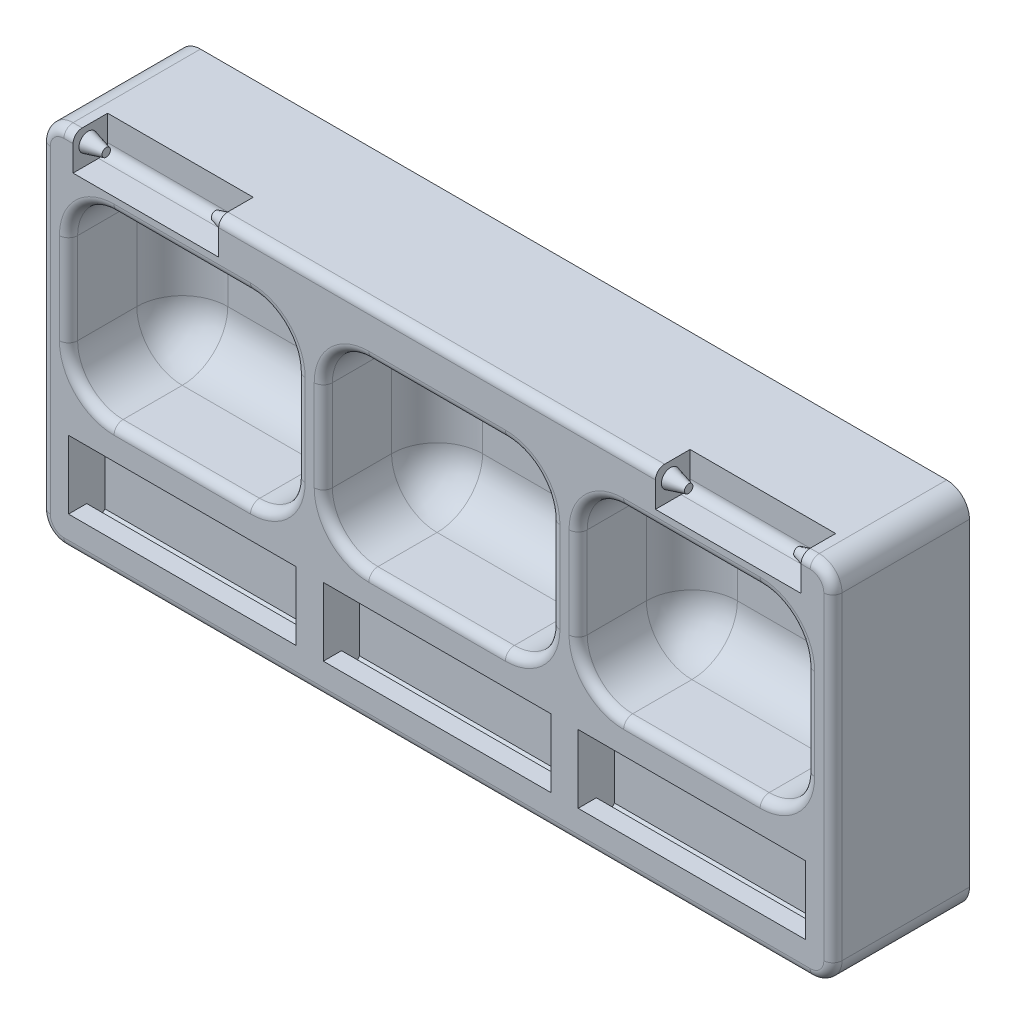
from build123d import *

# Parameters (mm, degrees)
SKICA1_W                = 174
SKICA1_H                = 80
P_IDAT_VYSUNUT_M1_DEPTH = 30
SKETCH2_W               = 50
SKETCH2_H               = 40
CUT_EXTRUDE2_DEPTH      = 25
FILLET1_R               = 10
FILLET2_R               = 10
FILLET3_R               = 10
FILLET6_R               = 2
FILLET7_R               = 2
FILLET8_R               = 2
FILLET9_R               = 5
SKETCH6_W               = 50
SKETCH6_H               = 15
CUT_EXTRUDE3_DEPTH      = 4
SKETCH12_W              = 50
SKETCH12_H              = 4
CUT_EXTRUDE5_DEPTH      = 2
SKETCH7_W               = 50
SKETCH7_H               = 20
CUT_EXTRUDE4_DEPTH      = 4
CHAMFER15_SIZE          = 2
SKETCH13_W              = 32
SKETCH13_H              = 7.6
CUT_EXTRUDE6_DEPTH      = 7.6
FILLET10_R              = 2
SKETCH22_R              = 2
BOSS_EXTRUDE7_DEPTH     = 4
BOSS_EXTRUDE7_TAPER     = 15
SKICA5_R                = 2
P_IDAT_VYSUNUT_M5_DEPTH = 4
P_IDAT_VYSUNUT_M5_TAPER = 15
SKICA6_R                = 2
P_IDAT_VYSUNUT_M6_DEPTH = 4
P_IDAT_VYSUNUT_M6_TAPER = 15
SKICA9_R                = 2
P_IDAT_VYSUNUT_M9_DEPTH = 4
P_IDAT_VYSUNUT_M9_TAPER = 15


# Some blends are built 0.0001 mm under size
with BuildPart() as part:
    # Skica1 → Přidat vysunutím1 (new body)
    with BuildSketch(Plane.XY):
        with Locations((87, 40)):
            Rectangle(SKICA1_W, SKICA1_H)
    extrude(amount=P_IDAT_VYSUNUT_M1_DEPTH)

    # Sketch2 → Cut-Extrude2 (cut)
    with BuildSketch(Plane.XY.offset(30)):
        with Locations((31, 49)):
            Rectangle(SKETCH2_W, SKETCH2_H)
        with Locations((87, 49)):
            Rectangle(SKETCH2_W, SKETCH2_H)
        with Locations((143, 49)):
            Rectangle(SKETCH2_W, SKETCH2_H)
    extrude(amount=-CUT_EXTRUDE2_DEPTH, mode=Mode.SUBTRACT)

    # Fillet1
    fillet1_edges = [part.edges().sort_by_distance(p)[0] for p in [
        (6, 49, 5),
        (6, 29, 17.5),
        (31, 69, 5),
        (6, 69, 17.5),
        (56, 49, 5),
        (56, 69, 17.5),
        (31, 29, 5),
        (56, 29, 17.5),
    ]]
    fillet(fillet1_edges, radius=FILLET1_R)

    # Fillet2
    fillet2_edges = [part.edges().sort_by_distance(p)[0] for p in [
        (62, 49, 5),
        (62, 29, 17.5),
        (87, 69, 5),
        (62, 69, 17.5),
        (112, 49, 5),
        (112, 69, 17.5),
        (87, 29, 5),
        (112, 29, 17.5),
    ]]
    fillet(fillet2_edges, radius=FILLET2_R)

    # Fillet3
    fillet3_edges = [part.edges().sort_by_distance(p)[0] for p in [
        (118, 49, 5),
        (118, 29, 17.5),
        (143, 69, 5),
        (118, 69, 17.5),
        (168, 49, 5),
        (168, 69, 17.5),
        (143, 29, 5),
        (168, 29, 17.5),
    ]]
    fillet(fillet3_edges, radius=FILLET3_R)

    # Fillet6
    fillet6_edges = [part.edges().sort_by_distance(p)[0] for p in [
        (112, 49, 30),
        (87, 29, 30),
        (62, 49, 30),
        (87, 69, 30),
        (109.071067812, 66.071067812, 30),
        (109.071067812, 31.928932188, 30),
        (64.928932188, 31.928932188, 30),
        (64.928932188, 66.071067812, 30),
    ]]
    fillet(fillet6_edges, radius=FILLET6_R)

    # Fillet7
    fillet7_edges = [part.edges().sort_by_distance(p)[0] for p in [
        (143, 69, 30),
        (168, 49, 30),
        (143, 29, 30),
        (118, 49, 30),
        (165.071067812, 66.071067812, 30),
        (165.071067812, 31.928932188, 30),
        (120.928932188, 31.928932188, 30),
        (120.928932188, 66.071067812, 30),
        (56, 49, 30),
        (31, 29, 30),
        (6, 49, 30),
        (31, 69, 30),
        (53.071067812, 31.928932188, 30),
        (8.928932188, 31.928932188, 30),
        (8.928932188, 66.071067812, 30),
        (53.071067812, 66.071067812, 30),
    ]]
    fillet(fillet7_edges, radius=FILLET7_R)

    # Fillet8
    fillet8_edges = [part.edges().sort_by_distance(p)[0] for p in [
        (87, 0, 30),
        (0, 40, 30),
        (87, 80, 30),
        (174, 40, 30),
    ]]
    fillet(fillet8_edges, radius=FILLET8_R)

    # Fillet9
    # the kernel refuses this fillet: 5 mm, written as the material it takes off along each edge
    with BuildSketch(Plane(origin=(5, 5, 30), x_dir=(-1, 0, 0), z_dir=(0, 1, 0))) as fillet9_piece_1:
        with BuildLine():
            CenterArc((3, -2), 2, 0, 90)
            Line((5, -2), (5, 0))
            Line((5, 0), (3, 0))
        make_face()
    revolve(axis=Axis((5, 5, 30), (0, 0, 1)), revolution_arc=90, mode=Mode.SUBTRACT)
    with BuildSketch(Plane(origin=(5, 75, 30), x_dir=(0, 1, 0), z_dir=(1, 0, 0))) as fillet9_piece_2:
        with BuildLine():
            CenterArc((3, -2), 2, 0, 90)
            Line((5, -2), (5, 0))
            Line((5, 0), (3, 0))
        make_face()
    revolve(axis=Axis((5, 75, 30), (0, 0, 1)), revolution_arc=90, mode=Mode.SUBTRACT)
    with BuildSketch(Plane(origin=(169, 5, 30), x_dir=(0, -1, 0), z_dir=(-1, 0, 0))) as fillet9_piece_3:
        with BuildLine():
            CenterArc((3, -2), 2, 0, 90)
            Line((5, -2), (5, 0))
            Line((5, 0), (3, 0))
        make_face()
    revolve(axis=Axis((169, 5, 30), (0, 0, 1)), revolution_arc=90, mode=Mode.SUBTRACT)
    with BuildSketch(Plane(origin=(169, 75, 30), x_dir=(1, 0, 0), z_dir=(0, -1, 0))) as fillet9_piece_4:
        with BuildLine():
            CenterArc((3, -2), 2, 0, 90)
            Line((5, -2), (5, 0))
            Line((5, 0), (3, 0))
        make_face()
    revolve(axis=Axis((169, 75, 30), (0, 0, 1)), revolution_arc=90, mode=Mode.SUBTRACT)
    with BuildSketch(Plane(origin=(174, 80, -12.5), x_dir=(0, -1, 0), z_dir=(0, 0, 1)), Plane(origin=(174, 0, -12.5), x_dir=(-1, 0, 0), z_dir=(0, 0, 1))) as fillet9_piece_5:
        with BuildLine():
            CenterArc((FILLET9_R, -FILLET9_R), FILLET9_R, 90, 90)
            Line((0, -FILLET9_R), (0, 0))
            Line((0, 0), (FILLET9_R, 0))
        make_face()
    extrude(amount=42.5, mode=Mode.SUBTRACT)
    with BuildSketch(Plane(origin=(0, 80, -12.5), x_dir=(0, -1, 0), z_dir=(0, 0, 1)), Plane(origin=(0, 0, -12.5), x_dir=(1, 0, 0), z_dir=(0, 0, 1))) as fillet9_piece_6:
        with BuildLine():
            CenterArc((FILLET9_R, FILLET9_R), FILLET9_R, 180, 90)
            Line((0, FILLET9_R), (0, 0))
            Line((0, 0), (FILLET9_R, 0))
        make_face()
    extrude(amount=42.5, mode=Mode.SUBTRACT)

    # Sketch6 → Cut-Extrude3 (cut)
    with BuildSketch(Plane.XY.offset(30)):
        with Locations((31, 14.5)):
            Rectangle(SKETCH6_W, SKETCH6_H)
        with Locations((87, 14.5)):
            Rectangle(SKETCH6_W, SKETCH6_H)
        with Locations((143, 14.5)):
            Rectangle(SKETCH6_W, SKETCH6_H)
    extrude(amount=-CUT_EXTRUDE3_DEPTH, mode=Mode.SUBTRACT)

    # Sketch12 → Cut-Extrude5 (cut)
    with BuildSketch(Plane.XY.offset(26)):
        with Locations((31, 2)):
            Rectangle(SKETCH12_W, SKETCH12_H)
        with Locations((87, 2)):
            Rectangle(SKETCH12_W, SKETCH12_H)
        with Locations((143, 2)):
            Rectangle(SKETCH12_W, SKETCH12_H)
    extrude(amount=-CUT_EXTRUDE5_DEPTH, mode=Mode.SUBTRACT)

    # Sketch7 → Cut-Extrude4 (cut)
    with BuildSketch(Plane.XY.offset(26)):
        with Locations((31, 14)):
            Rectangle(SKETCH7_W, SKETCH7_H)
        with Locations((143, 14)):
            Rectangle(SKETCH7_W, SKETCH7_H)
        with Locations((87, 14)):
            Rectangle(SKETCH7_W, SKETCH7_H)
    extrude(amount=-CUT_EXTRUDE4_DEPTH, mode=Mode.SUBTRACT)

    # Chamfer15
    chamfer15_edges = [part.edges().sort_by_distance(p)[0] for p in [
        (31, 4, 24),
        (143, 4, 24),
        (87, 4, 24),
    ]]
    chamfer(chamfer15_edges, length=CHAMFER15_SIZE - 0.0001)  # a hair under: the kernel refuses the full size

    # Sketch13 → Cut-Extrude6 (cut)
    with BuildSketch(Plane.XY.offset(30)):
        with Locations((23, 76.2)):
            Rectangle(SKETCH13_W, SKETCH13_H)
        with Locations((151, 76.2)):
            Rectangle(SKETCH13_W, SKETCH13_H)
    extrude(amount=-CUT_EXTRUDE6_DEPTH, mode=Mode.SUBTRACT)

    # Fillet10
    fillet10_edges = [part.edges().sort_by_distance(p)[0] for p in [
        (23, 72.4, 22.4),
        (151, 72.4, 22.4),
    ]]
    fillet(fillet10_edges, radius=FILLET10_R)

    # Sketch22 → Boss-Extrude7 (add)
    with BuildSketch(Plane.ZY.offset(-39)):
        with Locations((26.7, 76.7)):
            Circle(SKETCH22_R)
    extrude(amount=BOSS_EXTRUDE7_DEPTH, taper=BOSS_EXTRUDE7_TAPER)

    # Skica5 → Přidat vysunutím5 (add)
    with BuildSketch(Plane.ZY.offset(-167)):
        with Locations((26.7, 76.7)):
            Circle(SKICA5_R)
    extrude(amount=P_IDAT_VYSUNUT_M5_DEPTH, taper=P_IDAT_VYSUNUT_M5_TAPER)

    # Skica6 → Přidat vysunutím6 (add)
    with BuildSketch(Plane(origin=(135, 0, 0), x_dir=(0, 0, -1), z_dir=(1, 0, 0))):
        with Locations((-26.7, 76.7)):
            Circle(SKICA6_R)
    extrude(amount=P_IDAT_VYSUNUT_M6_DEPTH, taper=P_IDAT_VYSUNUT_M6_TAPER)

    # Skica9 → Přidat vysunutím9 (add)
    with BuildSketch(Plane(origin=(7, 0, 0), x_dir=(0, 0, -1), z_dir=(1, 0, 0))):
        with Locations((-26.7, 76.7)):
            Circle(SKICA9_R)
    extrude(amount=P_IDAT_VYSUNUT_M9_DEPTH, taper=P_IDAT_VYSUNUT_M9_TAPER)


solid = part.part
